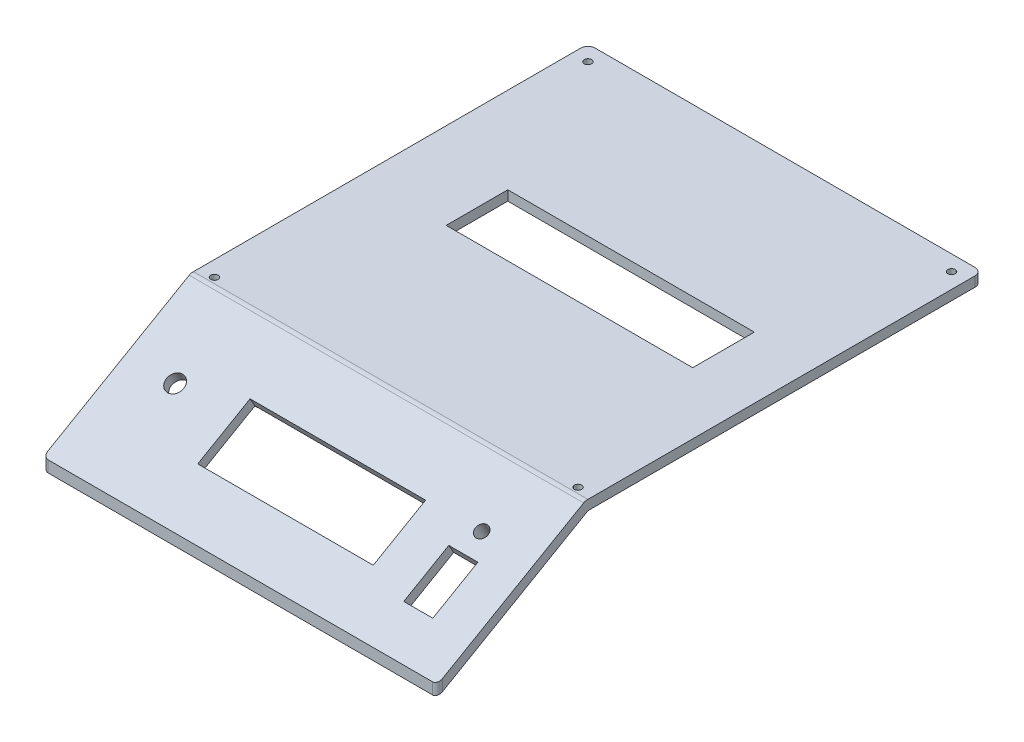
from build123d import *

# Parameters (mm, degrees)
SKETCH1_W           = 160
SKETCH1_H           = 160
SKETCH1_R           = 1.5
BOSS_EXTRUDE1_DEPTH = 4
SKETCH5_W           = 160
SKETCH5_H           = 75
BOSS_EXTRUDE4_DEPTH = 4
FILLET1_R           = 3
FILLET2_R           = 3
FILLET3_R           = 3
CUT_EXTRUDE6_DEPTH  = 165
FILLET8_R           = 2
FILLET9_R           = 2
SKETCH13_W          = 100
SKETCH13_H          = 25
CUT_EXTRUDE7_DEPTH  = 10
SKETCH17_W          = 71.2
SKETCH17_H          = 24.5
CUT_EXTRUDE10_DEPTH = 10
SKETCH20_R          = 2.5
BOSS_EXTRUDE5_DEPTH = 3.2
SKETCH21_W          = 11.8
SKETCH21_H          = 21.1
CUT_EXTRUDE11_DEPTH = 5
SKETCH23_R          = 2.55
CUT_EXTRUDE12_DEPTH = 4
SKETCH24_R          = 4
BOSS_EXTRUDE6_DEPTH = 4
SKETCH25_R          = 2.55
CUT_EXTRUDE15_DEPTH = 4
SKETCH26_R          = 3.5
CUT_EXTRUDE16_DEPTH = 10


with BuildPart() as part:
    # Sketch1 → Boss-Extrude1 (new body)
    with BuildSketch(Plane(origin=(0, 0, 0), x_dir=(1, 0, 0), z_dir=(0, 1, 0))):
        Rectangle(SKETCH1_W, SKETCH1_H)
        with Locations(Location((-73.75, 73.75, 0), (0, 0, 270))):
            Circle(SKETCH1_R, mode=Mode.SUBTRACT)
        with Locations(Location((73.75, 73.75, 0), (0, 0, 270))):
            Circle(SKETCH1_R, mode=Mode.SUBTRACT)
        with Locations(Location((-73.75, -77.75, 0), (0, 0, 270))):
            Circle(SKETCH1_R, mode=Mode.SUBTRACT)
        with Locations(Location((73.75, -77.75, 0), (0, 0, 270))):
            Circle(SKETCH1_R, mode=Mode.SUBTRACT)
    extrude(amount=BOSS_EXTRUDE1_DEPTH)

    # Sketch5 → Boss-Extrude4 (add)
    with BuildSketch(Plane(origin=(0, 34.641016151, 20), x_dir=(1, 0, 0), z_dir=(0, 0.8660254037844346, 0.5000000000000071))):
        with Locations((0, -104.782032303)):
            Rectangle(SKETCH5_W, SKETCH5_H)
    extrude(amount=BOSS_EXTRUDE4_DEPTH)

    # Fillet1
    # the kernel refuses this fillet: 3 mm, written as the material it takes off along each edge
    with BuildSketch(Plane(origin=(-84.277998386, 4.464101615, 80.267949192), x_dir=(0, -0.8660254037849107, -0.4999999999991824), z_dir=(1, 0, 0))) as fillet1_piece_1:
        with BuildLine():
            CenterArc((3, -1.711199354), FILLET1_R, 145.221891332, 34.778108668)
            Line((0, -1.711199354), (-0.06, -1.711199354))
            Line((-0.06, -1.711199354), (-0.06, 0))
            Line((-0.06, 0), (0, 0.06))
            ThreePointArc((0, 0.06), (0.267949192, 0.06), (0.486616353, 0.034223987))
            Line((0.486616353, 0.034223987), (0.535898385, 0))
        make_face()
    extrude(amount=168.555996772, mode=Mode.SUBTRACT)

    # Fillet2
    fillet2_edges = [part.edges().sort_by_distance(p)[0] for p in [
        (80, 2, -80),
    ]]
    fillet(fillet2_edges, radius=FILLET2_R)

    # Fillet3
    fillet3_edges = [part.edges().sort_by_distance(p)[0] for p in [
        (-80, 2, -80),
    ]]
    fillet(fillet3_edges, radius=FILLET3_R)

    # Sketch12 → Cut-Extrude6 (cut)
    with BuildSketch(Plane(origin=(80, 0, 0), x_dir=(0, 0, -1), z_dir=(1, 0, 0))):
        Polygon((-145.219854476, -33.035898385), (-143.219854476, -36.5), (-141.002829443, -35.22), (-141.002829443, -30.601197846), align=None)
    extrude(amount=-CUT_EXTRUDE6_DEPTH, mode=Mode.SUBTRACT)

    # Fillet8
    fillet8_edges = [part.edges().sort_by_distance(p)[0] for p in [
        (80, -32.910598923, 141.002829443),
    ]]
    fillet(fillet8_edges, radius=FILLET8_R)

    # Fillet9
    fillet9_edges = [part.edges().sort_by_distance(p)[0] for p in [
        (-80, -32.910598923, 141.002829443),
    ]]
    fillet(fillet9_edges, radius=FILLET9_R)

    # Sketch13 → Cut-Extrude7 (cut)
    with BuildSketch(Plane(origin=(0, 4, 0), x_dir=(1, 0, 0), z_dir=(0, 1, 0))):
        with Locations((5, 0)):
            Rectangle(SKETCH13_W, SKETCH13_H)
    extrude(amount=-CUT_EXTRUDE7_DEPTH, mode=Mode.SUBTRACT)

    # Sketch17 → Cut-Extrude10 (cut)
    with BuildSketch(Plane(origin=(0, 38.105117767, 22), x_dir=(1, 0, 0), z_dir=(0, 0.8660254037844344, 0.5000000000000073))):
        with Locations((0, -103.993231657)):
            Rectangle(SKETCH17_W, SKETCH17_H)
    extrude(amount=-CUT_EXTRUDE10_DEPTH, mode=Mode.SUBTRACT)

    # Sketch20 → Boss-Extrude5 (add)
    with BuildSketch(Plane(origin=(0, 34.641016151, 20), x_dir=(1, 0, 0), z_dir=(0, -0.8660254037844344, -0.5000000000000073))):
        with Locations(Location((-37.592365001, 119.501924995, 0), (0, 0, 270))):
            Circle(SKETCH20_R)
        with Locations(Location((37.567634999, 88.501924995, 0), (0, 0, 270))):
            Circle(SKETCH20_R)
        with Locations(Location((37.567634999, 119.501924995, 0), (0, 0, 270))):
            Circle(SKETCH20_R)
        with Locations(Location((-37.592365001, 88.501924995, 0), (0, 0, 270))):
            Circle(SKETCH20_R)
    extrude(amount=BOSS_EXTRUDE5_DEPTH)

    # Sketch21 → Cut-Extrude11 (cut)
    with BuildSketch(Plane(origin=(0, 38.105117767, 22), x_dir=(1, 0, 0), z_dir=(0, 0.8660254037844344, 0.5000000000000073))):
        with Locations((57.997068985, -110.479162625)):
            Rectangle(SKETCH21_W, SKETCH21_H)
    extrude(amount=-CUT_EXTRUDE11_DEPTH, mode=Mode.SUBTRACT)

    # Sketch23 → Cut-Extrude12 (cut)
    with BuildSketch(Plane(origin=(0, 38.105117767, 22), x_dir=(1, 0, 0), z_dir=(0, 0.8660254037844345, 0.5000000000000074))):
        with Locations(Location((58.097068985, -91.429162625, 0), (0, 0, 270))):
            Circle(SKETCH23_R)
    extrude(amount=-CUT_EXTRUDE12_DEPTH, mode=Mode.SUBTRACT)

    # Sketch24 → Boss-Extrude6 (add)
    with BuildSketch(Plane(origin=(0, 34.641016151, 20), x_dir=(1, 0, 0), z_dir=(0, -0.8660254037844344, -0.5000000000000073))):
        with Locations(Location((58.097068985, 91.429162625, 0), (0, 0, 90))):
            Circle(SKETCH24_R)
    extrude(amount=BOSS_EXTRUDE6_DEPTH)

    # Sketch25 → Cut-Extrude15 (cut)
    with BuildSketch(Plane(origin=(0, 34.641016151, 20), x_dir=(1, 0, 0), z_dir=(0, -0.8660254037844345, -0.5000000000000074))):
        with Locations(Location((58.097068985, 91.429162625, 0), (0, 0, 90))):
            Circle(SKETCH25_R)
    extrude(amount=CUT_EXTRUDE15_DEPTH, mode=Mode.SUBTRACT)

    # Sketch26 → Cut-Extrude16 (cut)
    with BuildSketch(Plane(origin=(0, 38.105117767, 22), x_dir=(1, 0, 0), z_dir=(0, 0.8660254037844345, 0.5000000000000074))):
        with Locations(Location((-59.8, -98.912631226, 0), (0, 0, 270))):
            Circle(SKETCH26_R)
    extrude(amount=-CUT_EXTRUDE16_DEPTH, mode=Mode.SUBTRACT)


solid = part.part
